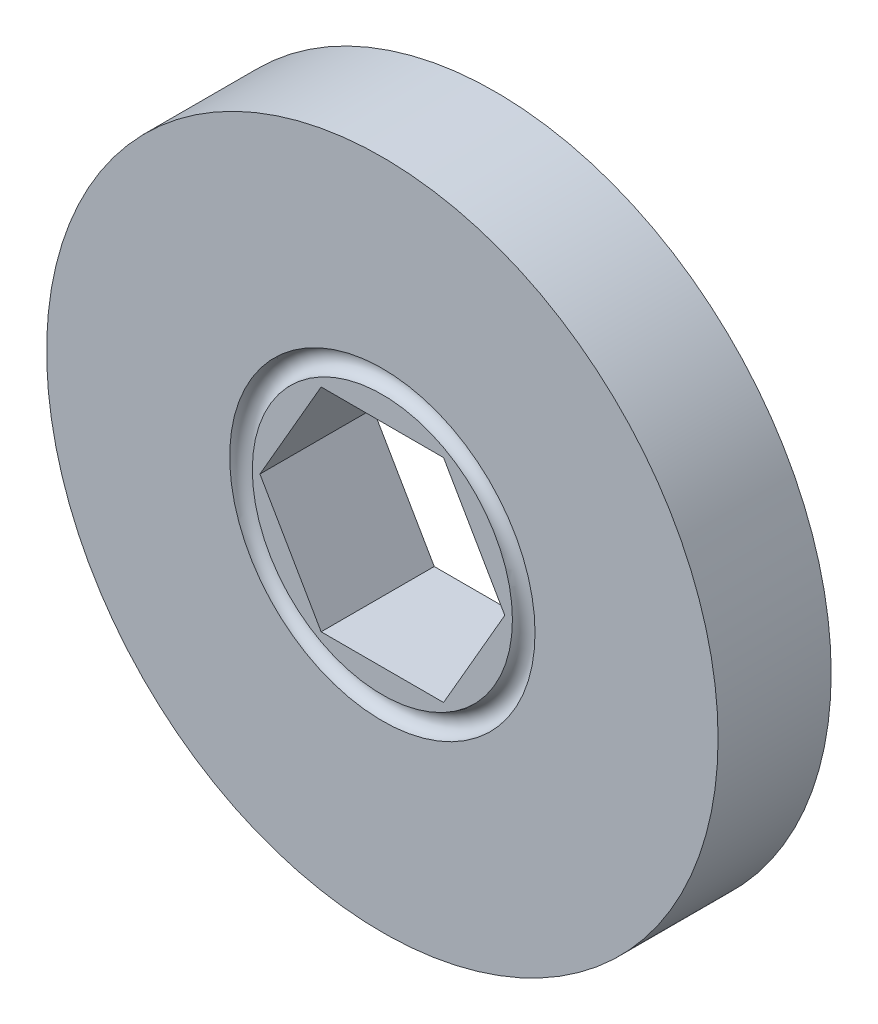
from build123d import *

# Parameters (mm, degrees)
CUT_EXTRUDE1_REACH = 45.849


with BuildPart() as part:
    # Sketch1 → Revolve1 (revolve)
    with BuildSketch(Plane(origin=(0, 0, 0), x_dir=(0, 0, -1), z_dir=(1, 0, 0))):
        with BuildLine():
            Line((-5.08, 30.1625), (5.08, 30.1625))
            Line((5.08, 30.1625), (5.08, 13.716))
            ThreePointArc((5.08, 13.716), (4.064, 12.7), (5.08, 11.684))
            Line((5.08, 11.684), (5.08, 0))
            Line((5.08, 0), (-5.08, 0))
            Line((-5.08, 0), (-5.08, 11.684))
            ThreePointArc((-5.08, 11.684), (-4.064, 12.7), (-5.08, 13.716))
            Line((-5.08, 13.716), (-5.08, 30.1625))
        make_face()
    revolve(axis=Axis((0, 0, 5.08), (0, 0, -1)))

    # Sketch2 → Cut-Extrude1 (cut, up to next)
    with BuildSketch(Plane.XY.offset(5.08), mode=Mode.PRIVATE) as cut_extrude1_sk1:
        Polygon((-5.499261314, 9.525), (-10.998522628, 0), (-5.499261314, -9.525), (5.499261314, -9.525), (10.998522628, 0), (5.499261314, 9.525), align=None)
    cut_extrude1_tool1 = extrude(cut_extrude1_sk1.sketch, amount=-CUT_EXTRUDE1_REACH, mode=Mode.PRIVATE) & part.part
    add(cut_extrude1_tool1.solids().sort_by_distance((0, 0, 5.08))[0], mode=Mode.SUBTRACT)


solid = part.part
